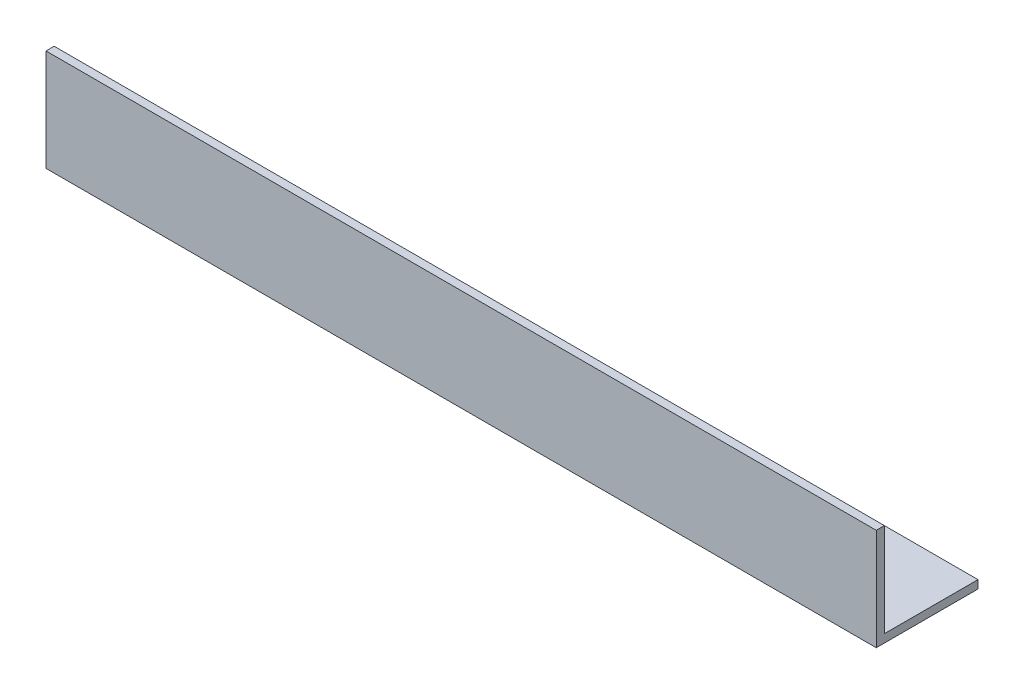
from build123d import *

# Parameters (mm, degrees)
EXTRUDE_1_DEPTH = 204


with BuildPart() as part:
    # Эскиз1 → Вытянуть-Тонкостенный1 (new body)
    with BuildSketch(Plane(origin=(0, 0, 0), x_dir=(0, 0, -1), z_dir=(1, 0, 0))):
        Polygon((0, 25), (0, 0), (25, 0), (25, 2), (2, 2), (2, 25), align=None)
    extrude(amount=EXTRUDE_1_DEPTH)


solid = part.part
